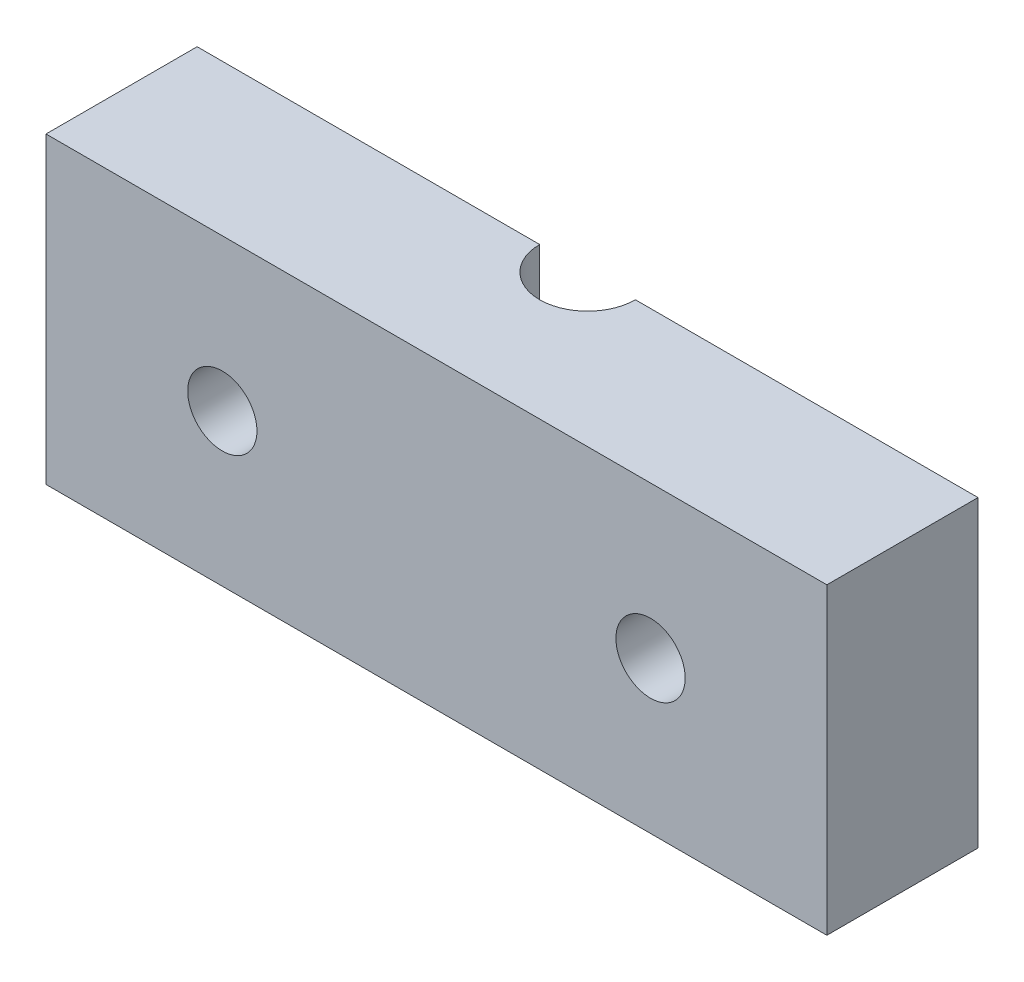
from build123d import *

# Parameters (mm, degrees)
SKETCH1_W        = 31
SKETCH1_H        = 12.05
SKETCH1_R        = 1.375
BASE_DEPTH       = 6
WIRE_GROVE_DEPTH = 21.529308318


with BuildPart() as part:
    # Sketch1 → Base (new body)
    with BuildSketch(Plane.XY):
        Rectangle(SKETCH1_W, SKETCH1_H)
        with Locations((-8.5, 0)):
            Circle(SKETCH1_R, mode=Mode.SUBTRACT)
        with Locations((8.5, 0)):
            Circle(SKETCH1_R, mode=Mode.SUBTRACT)
    extrude(amount=BASE_DEPTH)

    # Sketch2 → Wire Grove (cut, through all)
    with BuildSketch(Plane(origin=(0, 6.025, 0), x_dir=(1, 0, 0), z_dir=(0, 1, 0))):
        with BuildLine():
            Line((-1.9, 0), (1.9, 0))
            ThreePointArc((1.9, 0), (0, -1.9), (-1.9, 0))
        make_face()
    extrude(amount=-WIRE_GROVE_DEPTH, mode=Mode.SUBTRACT)


solid = part.part
